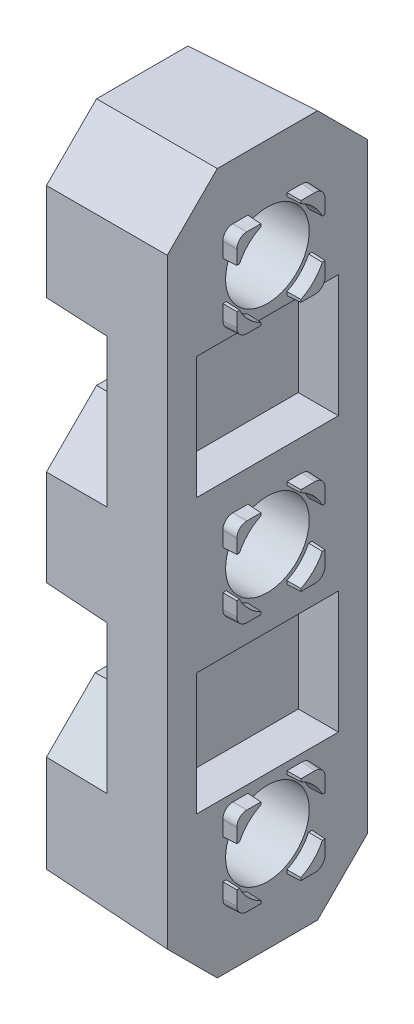
from build123d import *

# Parameters (mm, degrees)
SKETCH1_W            = 9.716506228
SKETCH1_H            = 35.116506228
BOSS_EXTRUDE1_DEPTH  = 6.35
CUT_EXTRUDE1_DEPTH   = 3.175
CUT_EXTRUDE2_DEPTH   = 3.175
CUT_EXTRUDE3_DEPTH   = 3.175
CUT_EXTRUDE4_DEPTH   = 3.175
BOSS_EXTRUDE2_DEPTH  = 0.6858
BOSS_EXTRUDE2_TAPER  = 2
BOSS_EXTRUDE3_DEPTH  = 0.6858
BOSS_EXTRUDE3_TAPER  = 2
BOSS_EXTRUDE4_DEPTH  = 0.6858
BOSS_EXTRUDE4_TAPER  = 2
BOSS_EXTRUDE5_DEPTH  = 0.6858
BOSS_EXTRUDE5_TAPER  = 2
BOSS_EXTRUDE6_DEPTH  = 0.6858
BOSS_EXTRUDE6_TAPER  = 2
BOSS_EXTRUDE7_DEPTH  = 0.6858
BOSS_EXTRUDE7_TAPER  = 2
BOSS_EXTRUDE8_DEPTH  = 0.6858
BOSS_EXTRUDE8_TAPER  = 2
BOSS_EXTRUDE9_DEPTH  = 0.6858
BOSS_EXTRUDE9_TAPER  = 2
BOSS_EXTRUDE10_DEPTH = 0.6858
BOSS_EXTRUDE10_TAPER = 2
BOSS_EXTRUDE11_DEPTH = 0.6858
BOSS_EXTRUDE11_TAPER = 2
BOSS_EXTRUDE12_DEPTH = 0.6858
BOSS_EXTRUDE12_TAPER = 2
BOSS_EXTRUDE13_DEPTH = 0.6858
BOSS_EXTRUDE13_TAPER = 2
SKETCH18_W           = 7.200000746
SKETCH18_H           = 6.200001039
CUT_EXTRUDE5_DEPTH   = 2.032
SKETCH19_W           = 7.200000746
SKETCH19_H           = 6.200000866
CUT_EXTRUDE6_DEPTH   = 2.032
DRAFT1_ANGLE         = 2.827279459
DRAFT2_ANGLE         = 2
HOLE1_D              = 4.2418
HOLE1_DEPTH          = 7.0358
CHAMFER1_SIZE        = 2.536908263
CHAMFER1_PART_2_SIZE = 2.536908263
FILLET1_R            = 0.507999989


with BuildPart() as part:
    # Sketch1 → Boss-Extrude1 (new body)
    with BuildSketch(Plane(origin=(88.976200533, 0, 0), x_dir=(0, 0, -1), z_dir=(1, 0, 0))):
        with Locations((12.699999697, 26.416015382)):
            Rectangle(SKETCH1_W, SKETCH1_H)
    extrude(amount=-BOSS_EXTRUDE1_DEPTH)

    # Sketch2 → Cut-Extrude1 (cut)
    with BuildSketch(Plane.ZY.offset(-82.626200533)):
        Polygon((-7.841746583, 36.509270747), (-10.315251163, 34.035766168), (-11.699992639, 34.035766168), (-11.699992639, 31.385266496), (-10.380199322, 31.385266496), (-7.841746583, 28.846813757), align=None)
    extrude(amount=-CUT_EXTRUDE1_DEPTH, mode=Mode.SUBTRACT)

    # Sketch3 → Cut-Extrude2 (cut)
    with BuildSketch(Plane.ZY.offset(-82.626200533)):
        Polygon((-7.841746583, 23.985217007), (-10.380199322, 21.446764268), (-11.699997599, 21.446764268), (-11.699997599, 18.796264596), (-10.315251163, 18.796264596), (-7.841746583, 16.322760016), align=None)
    extrude(amount=-CUT_EXTRUDE2_DEPTH, mode=Mode.SUBTRACT)

    # Sketch4 → Cut-Extrude3 (cut)
    with BuildSketch(Plane.ZY.offset(-82.626200533)):
        Polygon((-17.558252811, 16.322760016), (-15.084748232, 18.796264596), (-13.699997366, 18.796264596), (-13.699997366, 21.446764268), (-15.019800072, 21.446764268), (-17.558252811, 23.985217007), align=None)
    extrude(amount=-CUT_EXTRUDE3_DEPTH, mode=Mode.SUBTRACT)

    # Sketch5 → Cut-Extrude4 (cut)
    with BuildSketch(Plane.ZY.offset(-82.626200533)):
        Polygon((-17.558252811, 28.846813757), (-15.019800072, 31.385266496), (-13.699992522, 31.385266496), (-13.699992522, 34.035766168), (-15.084748232, 34.035766168), (-17.558252811, 36.509270747), align=None)
    extrude(amount=-CUT_EXTRUDE4_DEPTH, mode=Mode.SUBTRACT)

    # Sketch6 → Boss-Extrude2 (add)
    with BuildSketch(Plane(origin=(88.976200533, 0, 0), x_dir=(0, 0, -1), z_dir=(1, 0, 0))):
        with BuildLine():
            ThreePointArc((11.709394811, 24.327642329), (11.065588197, 24.781603881), (10.611626644, 25.425410496))
            Line((10.611626644, 25.425410496), (10.439394811, 25.425410496))
            Line((10.439394811, 25.425410496), (10.439394811, 24.155410496))
            Line((10.439394811, 24.155410496), (11.709394811, 24.155410496))
            Line((11.709394811, 24.155410496), (11.709394811, 24.327642329))
        make_face()
    extrude(amount=BOSS_EXTRUDE2_DEPTH, taper=BOSS_EXTRUDE2_TAPER)

    # Sketch7 → Boss-Extrude3 (add)
    with BuildSketch(Plane(origin=(88.976200533, 0, 0), x_dir=(0, 0, -1), z_dir=(1, 0, 0))):
        with BuildLine():
            ThreePointArc((14.788362978, 25.425410496), (14.334401425, 24.781603881), (13.690594811, 24.327642329))
            Line((13.690594811, 24.327642329), (13.690594811, 24.155410496))
            Line((13.690594811, 24.155410496), (14.960594811, 24.155410496))
            Line((14.960594811, 24.155410496), (14.960594811, 25.425410496))
            Line((14.960594811, 25.425410496), (14.788362978, 25.425410496))
        make_face()
    extrude(amount=BOSS_EXTRUDE3_DEPTH, taper=BOSS_EXTRUDE3_TAPER)

    # Sketch8 → Boss-Extrude4 (add)
    with BuildSketch(Plane(origin=(88.976200533, 0, 0), x_dir=(0, 0, -1), z_dir=(1, 0, 0))):
        with BuildLine():
            ThreePointArc((13.690594811, 28.504378662), (14.334401425, 28.05041711), (14.788362978, 27.406610496))
            Line((14.788362978, 27.406610496), (14.960594811, 27.406610496))
            Line((14.960594811, 27.406610496), (14.960594811, 28.676610496))
            Line((14.960594811, 28.676610496), (13.690594811, 28.676610496))
            Line((13.690594811, 28.676610496), (13.690594811, 28.504378662))
        make_face()
    extrude(amount=BOSS_EXTRUDE4_DEPTH, taper=BOSS_EXTRUDE4_TAPER)

    # Sketch9 → Boss-Extrude5 (add)
    with BuildSketch(Plane(origin=(88.976200533, 0, 0), x_dir=(0, 0, -1), z_dir=(1, 0, 0))):
        with BuildLine():
            ThreePointArc((10.611626644, 27.406610496), (11.065588197, 28.05041711), (11.709394811, 28.504378662))
            Line((11.709394811, 28.504378662), (11.709394811, 28.676610496))
            Line((11.709394811, 28.676610496), (10.439394811, 28.676610496))
            Line((10.439394811, 28.676610496), (10.439394811, 27.406610496))
            Line((10.439394811, 27.406610496), (10.611626644, 27.406610496))
        make_face()
    extrude(amount=BOSS_EXTRUDE5_DEPTH, taper=BOSS_EXTRUDE5_TAPER)

    # Sketch10 → Boss-Extrude6 (add)
    with BuildSketch(Plane(origin=(88.976200533, 0, 0), x_dir=(0, 0, -1), z_dir=(1, 0, 0))):
        with BuildLine():
            ThreePointArc((11.709394811, 37.027642329), (11.065588197, 37.481603881), (10.611626644, 38.125410496))
            Line((10.611626644, 38.125410496), (10.439394811, 38.125410496))
            Line((10.439394811, 38.125410496), (10.439394811, 36.855410496))
            Line((10.439394811, 36.855410496), (11.709394811, 36.855410496))
            Line((11.709394811, 36.855410496), (11.709394811, 37.027642329))
        make_face()
    extrude(amount=BOSS_EXTRUDE6_DEPTH, taper=BOSS_EXTRUDE6_TAPER)

    # Sketch11 → Boss-Extrude7 (add)
    with BuildSketch(Plane(origin=(88.976200533, 0, 0), x_dir=(0, 0, -1), z_dir=(1, 0, 0))):
        with BuildLine():
            ThreePointArc((14.788362978, 38.125410496), (14.334401425, 37.481603881), (13.690594811, 37.027642329))
            Line((13.690594811, 37.027642329), (13.690594811, 36.855410496))
            Line((13.690594811, 36.855410496), (14.960594811, 36.855410496))
            Line((14.960594811, 36.855410496), (14.960594811, 38.125410496))
            Line((14.960594811, 38.125410496), (14.788362978, 38.125410496))
        make_face()
    extrude(amount=BOSS_EXTRUDE7_DEPTH, taper=BOSS_EXTRUDE7_TAPER)

    # Sketch12 → Boss-Extrude8 (add)
    with BuildSketch(Plane(origin=(88.976200533, 0, 0), x_dir=(0, 0, -1), z_dir=(1, 0, 0))):
        with BuildLine():
            ThreePointArc((13.690594811, 41.204378662), (14.334401425, 40.75041711), (14.788362978, 40.106610496))
            Line((14.788362978, 40.106610496), (14.960594811, 40.106610496))
            Line((14.960594811, 40.106610496), (14.960594811, 41.376610496))
            Line((14.960594811, 41.376610496), (13.690594811, 41.376610496))
            Line((13.690594811, 41.376610496), (13.690594811, 41.204378662))
        make_face()
    extrude(amount=BOSS_EXTRUDE8_DEPTH, taper=BOSS_EXTRUDE8_TAPER)

    # Sketch13 → Boss-Extrude9 (add)
    with BuildSketch(Plane(origin=(88.976200533, 0, 0), x_dir=(0, 0, -1), z_dir=(1, 0, 0))):
        with BuildLine():
            ThreePointArc((10.611626644, 40.106610496), (11.065588197, 40.75041711), (11.709394811, 41.204378662))
            Line((11.709394811, 41.204378662), (11.709394811, 41.376610496))
            Line((11.709394811, 41.376610496), (10.439394811, 41.376610496))
            Line((10.439394811, 41.376610496), (10.439394811, 40.106610496))
            Line((10.439394811, 40.106610496), (10.611626644, 40.106610496))
        make_face()
    extrude(amount=BOSS_EXTRUDE9_DEPTH, taper=BOSS_EXTRUDE9_TAPER)

    # Sketch14 → Boss-Extrude10 (add)
    with BuildSketch(Plane(origin=(88.976200533, 0, 0), x_dir=(0, 0, -1), z_dir=(1, 0, 0))):
        with BuildLine():
            ThreePointArc((11.709394811, 11.627642329), (11.065588197, 12.081603882), (10.611626644, 12.725410496))
            Line((10.611626644, 12.725410496), (10.439394811, 12.725410496))
            Line((10.439394811, 12.725410496), (10.439394811, 11.455410496))
            Line((10.439394811, 11.455410496), (11.709394811, 11.455410496))
            Line((11.709394811, 11.455410496), (11.709394811, 11.627642329))
        make_face()
    extrude(amount=BOSS_EXTRUDE10_DEPTH, taper=BOSS_EXTRUDE10_TAPER)

    # Sketch15 → Boss-Extrude11 (add)
    with BuildSketch(Plane(origin=(88.976200533, 0, 0), x_dir=(0, 0, -1), z_dir=(1, 0, 0))):
        with BuildLine():
            ThreePointArc((14.788362978, 12.725410496), (14.334401425, 12.081603882), (13.690594811, 11.627642329))
            Line((13.690594811, 11.627642329), (13.690594811, 11.455410496))
            Line((13.690594811, 11.455410496), (14.960594811, 11.455410496))
            Line((14.960594811, 11.455410496), (14.960594811, 12.725410496))
            Line((14.960594811, 12.725410496), (14.788362978, 12.725410496))
        make_face()
    extrude(amount=BOSS_EXTRUDE11_DEPTH, taper=BOSS_EXTRUDE11_TAPER)

    # Sketch16 → Boss-Extrude12 (add)
    with BuildSketch(Plane(origin=(88.976200533, 0, 0), x_dir=(0, 0, -1), z_dir=(1, 0, 0))):
        with BuildLine():
            ThreePointArc((13.690594811, 15.804378662), (14.334401425, 15.35041711), (14.788362978, 14.706610496))
            Line((14.788362978, 14.706610496), (14.960594811, 14.706610496))
            Line((14.960594811, 14.706610496), (14.960594811, 15.976610496))
            Line((14.960594811, 15.976610496), (13.690594811, 15.976610496))
            Line((13.690594811, 15.976610496), (13.690594811, 15.804378662))
        make_face()
    extrude(amount=BOSS_EXTRUDE12_DEPTH, taper=BOSS_EXTRUDE12_TAPER)

    # Sketch17 → Boss-Extrude13 (add)
    with BuildSketch(Plane(origin=(88.976200533, 0, 0), x_dir=(0, 0, -1), z_dir=(1, 0, 0))):
        with BuildLine():
            ThreePointArc((10.611626644, 14.706610496), (11.065588197, 15.35041711), (11.709394811, 15.804378662))
            Line((11.709394811, 15.804378662), (11.709394811, 15.976610496))
            Line((11.709394811, 15.976610496), (10.439394811, 15.976610496))
            Line((10.439394811, 15.976610496), (10.439394811, 14.706610496))
            Line((10.439394811, 14.706610496), (10.611626644, 14.706610496))
        make_face()
    extrude(amount=BOSS_EXTRUDE13_DEPTH, taper=BOSS_EXTRUDE13_TAPER)

    # Sketch18 → Cut-Extrude5 (cut)
    with BuildSketch(Plane(origin=(88.976200533, 0, 0), x_dir=(0, 0, -1), z_dir=(1, 0, 0))):
        with Locations((12.699998305, 19.46600963)):
            Rectangle(SKETCH18_W, SKETCH18_H)
    extrude(amount=-CUT_EXTRUDE5_DEPTH, mode=Mode.SUBTRACT)

    # Sketch19 → Cut-Extrude6 (cut)
    with BuildSketch(Plane(origin=(88.976200533, 0, 0), x_dir=(0, 0, -1), z_dir=(1, 0, 0))):
        with Locations((12.699992957, 33.366009543)):
            Rectangle(SKETCH19_W, SKETCH19_H)
    extrude(amount=-CUT_EXTRUDE6_DEPTH, mode=Mode.SUBTRACT)

    # Draft1
    draft1_faces = [part.faces().sort_by_distance(p)[0] for p in [
        (84.213700533, 30.116040126, -9.110972953),
        (84.213700533, 22.715990637, -9.110972953),
        (84.213700533, 22.715990637, -16.289026442),
        (84.213700533, 30.116040126, -16.289026442),
    ]]
    draft(draft1_faces, Plane(origin=(82.626200533, 0, 0), x_dir=(0, 0, -1), z_dir=(-1, 0, 0)), DRAFT1_ANGLE)

    # Draft2
    draft2_faces = [part.faces().sort_by_distance(p)[0] for p in [
        (85.801200533, 43.974268496, -12.699999697),
        (84.213700533, 35.272518458, -9.078498873),
        (84.213700533, 34.035766168, -11.007621901),
        (84.254709755, 31.385266496, -10.983227185),
        (84.254709612, 21.446764268, -10.98322967),
        (84.213700533, 18.796264596, -11.007624381),
        (84.213700533, 17.559512306, -9.078498873),
        (86.238234569, 26.416015382, -7.841746583),
        (85.801200533, 8.857762268, -12.699999697),
        (84.213700533, 17.559512306, -16.321500521),
        (84.213700533, 18.796264596, -14.392372799),
        (84.254709485, 21.446764268, -14.416767505),
        (84.254709347, 31.385266496, -14.416765078),
        (84.213700533, 34.035766168, -14.392370377),
        (84.213700533, 35.272518458, -16.321500521),
        (86.238234569, 26.416015382, -17.558252811),
    ]]
    draft(draft2_faces, Plane(origin=(82.626200533, 0, 0), x_dir=(0, 0, -1), z_dir=(-1, 0, 0)), DRAFT2_ANGLE)

    # Hole1
    with Locations(Plane.ZY.offset(-82.626200533)):
        with Locations((-12.699994811, 26.416010496), (-12.699999697, 13.716015382), (-12.699999697, 39.116015382)):
            Hole(HOLE1_D / 2, depth=HOLE1_DEPTH)

    # Chamfer1
    chamfer1_edges = [part.edges().sort_by_distance(p)[0] for p in [
        (85.801200533, 8.746888825, -17.669126254),
        (85.801200533, 8.746888825, -7.73087314),
    ]]
    chamfer(chamfer1_edges, length=CHAMFER1_SIZE)

    # Chamfer1 part 2
    chamfer1_part_2_edges = [part.edges().sort_by_distance(p)[0] for p in [
        (85.801200533, 44.085141939, -17.669126254),
        (85.801200533, 44.085141939, -7.73087314),
    ]]
    chamfer(chamfer1_part_2_edges, length=CHAMFER1_PART_2_SIZE)

    # Fillet1
    fillet1_edges = [part.edges().sort_by_distance(p)[0] for p in [
        (89.319100533, 41.364636164, -10.451369143),
        (89.319100533, 15.964636164, -10.451369143),
        (89.319100533, 11.467384827, -14.948620479),
        (89.319100533, 24.167384827, -10.451369143),
        (89.319100533, 41.364636164, -14.948620479),
        (89.319100533, 24.167384827, -14.948620479),
        (89.319100533, 11.467384827, -10.451369143),
        (89.319100533, 28.664636164, -14.948620479),
        (89.319100533, 15.964636164, -14.948620479),
        (89.319100533, 36.867384827, -10.451369143),
        (89.319100533, 36.867384827, -14.948620479),
        (89.319100533, 28.664636164, -10.451369143),
    ]]
    fillet(fillet1_edges, radius=FILLET1_R)


solid = part.part
